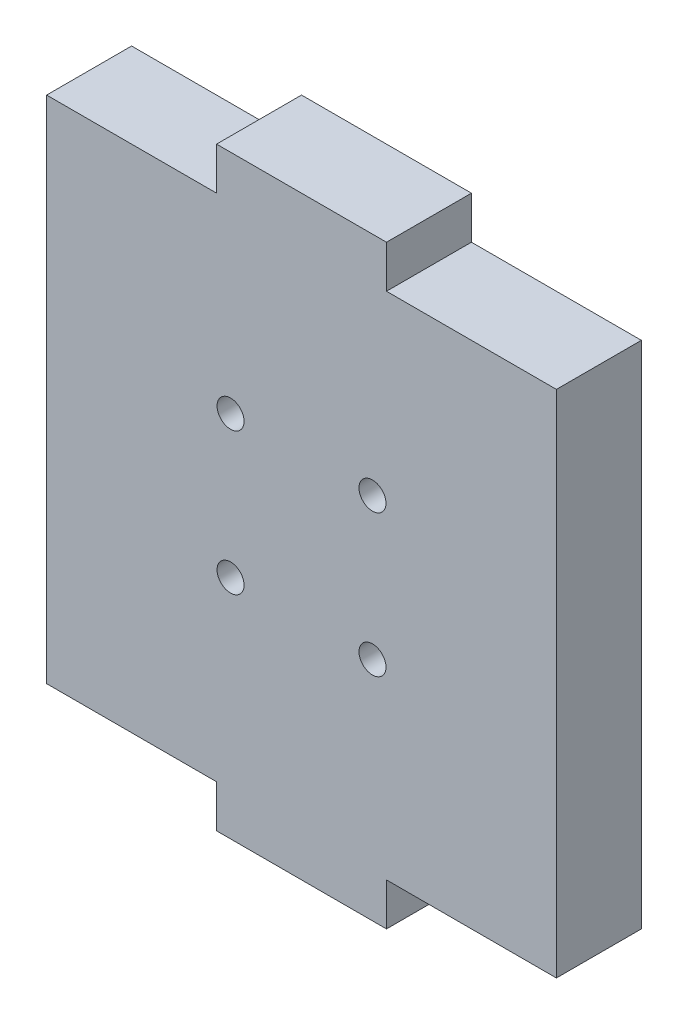
from build123d import *

# Parameters (mm, degrees)
BOSS_EXTRUDE1_DEPTH = 12.7
SKETCH2_R           = 2.0193
CUT_EXTRUDE1_DEPTH  = 60.905780189


with BuildPart() as part:
    # Sketch1 → Boss-Extrude1 (new body)
    with BuildSketch(Plane.XY):
        Polygon((-38.1, 38.1), (-38.1, -38.1), (-12.7, -38.1), (-12.7, -44.45), (12.7, -44.45), (12.7, -38.1), (38.1, -38.1), (38.1, 38.1), (12.7, 38.1), (12.7, 44.45), (-12.7, 44.45), (-12.7, 38.1), align=None)
    extrude(amount=BOSS_EXTRUDE1_DEPTH)

    # Sketch2 → Cut-Extrude1 (cut, through all)
    with BuildSketch(Plane.XY.offset(12.7)):
        with Locations((10.606601718, 10.606601718)):
            Circle(SKETCH2_R)
        with Locations((10.606601718, -10.606601718)):
            Circle(SKETCH2_R)
        with Locations((-10.606601718, -10.606601718)):
            Circle(SKETCH2_R)
        with Locations((-10.606601718, 10.606601718)):
            Circle(SKETCH2_R)
    extrude(amount=-CUT_EXTRUDE1_DEPTH, mode=Mode.SUBTRACT)


solid = part.part
